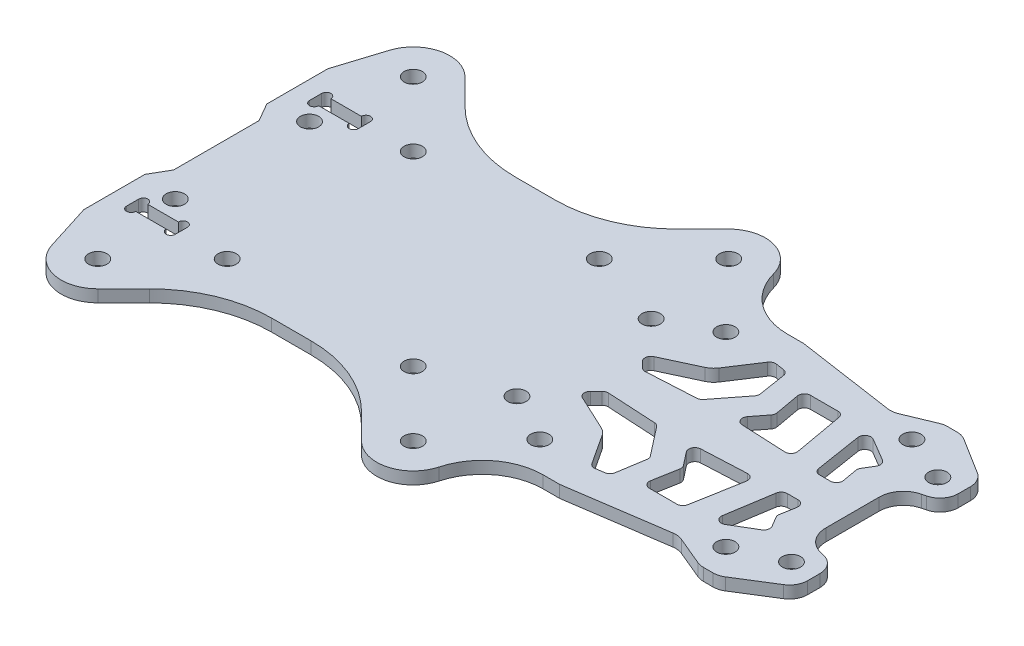
from build123d import *

# Parameters (mm, degrees)
SKETCH1_R           = 1.5
BOSS_EXTRUDE1_DEPTH = 2
FILLET1_R           = 20
FILLET2_R           = 10
FILLET8_DEPTH       = 2
FILLET9_R           = 3
FILLET10_R          = 4
SKETCH2_R           = 1.5
CUT_EXTRUDE1_DEPTH  = 85.27836671
CUT_EXTRUDE2_DEPTH  = 85.27836671
FILLET11_R          = 1
FILLET12_R          = 3


with BuildPart() as part:
    # Sketch1 → Boss-Extrude1 (new body)
    with BuildSketch(Plane(origin=(0, 0, 0), x_dir=(1, 0, 0), z_dir=(0, 1, 0))):
        with BuildLine():
            Line((-28.485281374, 20), (-34, 20))
            Line((-34, 20), (-34, 9.992729247))
            Line((-34, 9.992729247), (-32.274190039, 6.998022761))
            Line((-32.274190039, 6.998022761), (-32.274190039, -7))
            Line((-32.274190039, -7), (-34, -9.992734036))
            Line((-34, -9.992734036), (-34, -20))
            Line((-34, -20), (-28.485281374, -20))
            Line((-28.485281374, -20), (-30.099242405, -21.613961031))
            ThreePointArc((-30.099242405, -21.613961031), (-30.099242405, -30.099242405), (-21.613961031, -30.099242405))
            Line((-21.613961031, -30.099242405), (-11.514718626, -20))
            Line((-11.514718626, -20), (11.514718626, -20))
            Line((11.514718626, -20), (21.613961031, -30.099242405))
            ThreePointArc((21.613961031, -30.099242405), (30.099242405, -30.099242405), (30.099242405, -21.613961031))
            Line((30.099242405, -21.613961031), (28.485281374, -20))
            Line((28.485281374, -20), (44, -20))
            Line((44, -20), (61, -17.5))
            Line((61, -17.5), (67, -20))
            Line((67, -20), (70, -20))
            Line((70, -20), (78, -15))
            Line((78, -15), (78, -9))
            Line((78, -9), (72, -7.5))
            Line((72, -7.5), (72, 7.5))
            Line((72, 7.5), (78, 9))
            Line((78, 9), (78, 15))
            Line((78, 15), (70, 20))
            Line((70, 20), (67, 20))
            Line((67, 20), (61, 17.5))
            Line((61, 17.5), (44, 20))
            Line((44, 20), (28.485281374, 20))
            Line((28.485281374, 20), (30.099242405, 21.613961031))
            ThreePointArc((30.099242405, 21.613961031), (30.099242405, 30.099242405), (21.613961031, 30.099242405))
            Line((21.613961031, 30.099242405), (11.514718626, 20))
            Line((11.514718626, 20), (-11.514718626, 20))
            Line((-11.514718626, 20), (-21.613961031, 30.099242405))
            ThreePointArc((-21.613961031, 30.099242405), (-30.099242405, 30.099242405), (-30.099242405, 21.613961031))
            Line((-30.099242405, 21.613961031), (-28.485281374, 20))
        make_face()
        with Locations(Location((-25.856601718, -25.856601718, 0), (0, 0, 270))):
            Circle(SKETCH1_R, mode=Mode.SUBTRACT)
        with BuildLine():
            ThreePointArc((-24.5, -14), (-23.75, -13.25), (-23, -14))
            Line((-23, -14), (-23, -16))
            ThreePointArc((-23, -16), (-23.75, -16.75), (-24.5, -16))
            Line((-24.5, -16), (-29.5, -16))
            ThreePointArc((-29.5, -16), (-30.25, -16.75), (-31, -16))
            Line((-31, -16), (-31, -14))
            ThreePointArc((-31, -14), (-30.25, -13.25), (-29.5, -14))
            Line((-29.5, -14), (-24.5, -14))
        make_face(mode=Mode.SUBTRACT)
        with Locations(Location((-28, -11, 0), (0, 0, 270))):
            Circle(SKETCH1_R, mode=Mode.SUBTRACT)
        with Locations(Location((-15.25, -15.25, 0), (0, 0, 270))):
            Circle(SKETCH1_R, mode=Mode.SUBTRACT)
        with Locations(Location((15.25, -15.25, 0), (0, 0, 270))):
            Circle(SKETCH1_R, mode=Mode.SUBTRACT)
        with Locations(Location((28, -11, 0), (0, 0, 270))):
            Circle(SKETCH1_R, mode=Mode.SUBTRACT)
        with Locations(Location((74, -12, 0), (0, 0, 270))):
            Circle(SKETCH1_R, mode=Mode.SUBTRACT)
        with Locations(Location((-28, 11, 0), (0, 0, 270))):
            Circle(SKETCH1_R, mode=Mode.SUBTRACT)
        with BuildLine():
            Line((-23, 16), (-23, 14))
            ThreePointArc((-23, 14), (-23.75, 13.25), (-24.5, 14))
            Line((-24.5, 14), (-29.5, 14))
            ThreePointArc((-29.5, 14), (-30.25, 13.25), (-31, 14))
            Line((-31, 14), (-31, 16))
            ThreePointArc((-31, 16), (-30.25, 16.75), (-29.5, 16))
            Line((-29.5, 16), (-24.5, 16))
            ThreePointArc((-24.5, 16), (-23.75, 16.75), (-23, 16))
        make_face(mode=Mode.SUBTRACT)
        with Locations(Location((-15.25, 15.25, 0), (0, 0, 270))):
            Circle(SKETCH1_R, mode=Mode.SUBTRACT)
        with Locations(Location((15.25, 15.25, 0), (0, 0, 270))):
            Circle(SKETCH1_R, mode=Mode.SUBTRACT)
        with Locations(Location((28, 11, 0), (0, 0, 270))):
            Circle(SKETCH1_R, mode=Mode.SUBTRACT)
        with Locations(Location((74, 12, 0), (0, 0, 270))):
            Circle(SKETCH1_R, mode=Mode.SUBTRACT)
        with Locations(Location((-25.856601718, 25.856601718, 0), (0, 0, 270))):
            Circle(SKETCH1_R, mode=Mode.SUBTRACT)
        with Locations(Location((25.856601718, 25.856601718, 0), (0, 0, 270))):
            Circle(SKETCH1_R, mode=Mode.SUBTRACT)
        with Locations(Location((25.856601718, -25.856601718, 0), (0, 0, 270))):
            Circle(SKETCH1_R, mode=Mode.SUBTRACT)
    extrude(amount=BOSS_EXTRUDE1_DEPTH)

    # Fillet1
    fillet1_edges = [part.edges().sort_by_distance(p)[0] for p in [
        (-11.514718626, 1, -20),
        (11.514718626, 1, -20),
        (11.514718626, 1, 20),
        (-11.514718626, 1, 20),
    ]]
    fillet(fillet1_edges, radius=FILLET1_R)

    # Fillet2
    fillet2_edges = [part.edges().sort_by_distance(p)[0] for p in [
        (28.485281374, 1, -20),
        (28.485281374, 1, 20),
    ]]
    fillet(fillet2_edges, radius=FILLET2_R)

    # Fillet8: read off the stored shape, not the designer's step
    # Fillet8 outline → Fillet8 (add)
    with BuildSketch(Plane(origin=(0, 0, 0), x_dir=(1, 0, 0), z_dir=(0, 1, 0))):
        with BuildLine():
            ThreePointArc((-31.578419532, 27.662370502), (-32.788440089, 23.830942006), (-34, 20))
            Line((-34, 20), (-28.485281374, 20))
            Line((-28.485281374, 20), (-30.099242405, 21.613961031))
            ThreePointArc((-30.099242405, 21.613961031), (-31.684845243, 24.431267578), (-31.578419532, 27.662370502))
        make_face()
        with BuildLine():
            ThreePointArc((-34, -20), (-32.788440089, -23.830942006), (-31.578419532, -27.662370502))
            ThreePointArc((-31.578419532, -27.662370502), (-31.684845243, -24.431267578), (-30.099242405, -21.613961031))
            Line((-30.099242405, -21.613961031), (-28.485281374, -20))
            Line((-28.485281374, -20), (-34, -20))
        make_face()
    extrude(amount=FILLET8_DEPTH)

    # Fillet9
    fillet9_edges = [part.edges().sort_by_distance(p)[0] for p in [
        (61, 1, -17.5),
        (67, 1, -20),
        (70, 1, -20),
        (78, 1, -15),
        (78, 1, -9),
        (78, 1, 9),
        (78, 1, 15),
        (70, 1, 20),
        (67, 1, 20),
        (61, 1, 17.5),
    ]]
    fillet(fillet9_edges, radius=FILLET9_R)

    # Fillet10
    fillet10_edges = [part.edges().sort_by_distance(p)[0] for p in [
        (72, 1, -7.5),
        (72, 1, 7.5),
    ]]
    fillet(fillet10_edges, radius=FILLET10_R)

    # Sketch2 → Cut-Extrude1 (cut, through all)
    with BuildSketch(Plane(origin=(0, 2, 0), x_dir=(1, 0, 0), z_dir=(0, 1, 0))):
        with Locations(Location((66.5, -15.25, 0), (0, 0, 270))):
            Circle(SKETCH2_R)
        with Locations(Location((66.5, 15.25, 0), (0, 0, 270))):
            Circle(SKETCH2_R)
        with Locations(Location((36, -15.25, 0), (0, 0, 270))):
            Circle(SKETCH2_R)
        with Locations(Location((36, 15.25, 0), (0, 0, 270))):
            Circle(SKETCH2_R)
    extrude(amount=-CUT_EXTRUDE1_DEPTH, mode=Mode.SUBTRACT)

    # Sketch3 → Cut-Extrude2 (cut, through all)
    with BuildSketch(Plane(origin=(0, 2, 0), x_dir=(1, 0, 0), z_dir=(0, 1, 0))):
        Polygon((34.569062784, -3), (32.311365363, -5.257697421), (40.083766321, -8.884817868), (44.04629349, -14.939415582), (46.774410022, -14.538221974), (47.68263762, -8.884817868), (43.478247161, -3.49719071), align=None)
        Polygon((59.073968106, -3), (48.593588886, -3.49719071), (51.74688173, -7.526398233), (50.730820703, -13.202325352), (57.247625913, -13.202325352), align=None)
        Polygon((63.114876648, -2.645444048), (61.446344058, -13.202325352), (67.86927054, -9.396866308), (66.21976999, -6.612807763), (66.929977074, -2.645444048), align=None)
        Polygon((44.04629349, 14.939415582), (40.083766321, 8.884817868), (32.311365363, 5.257697421), (34.569062784, 3), (43.478247161, 3.49719071), (47.68263762, 8.884817868), (46.774410022, 14.538221974), align=None)
        Polygon((61.446344058, 13.202325352), (63.114876648, 2.645444048), (66.929977074, 2.645444048), (66.21976999, 6.612807763), (67.86927054, 9.396866308), align=None)
        Polygon((48.593588886, 3.49719071), (59.073968106, 3), (57.247625913, 13.202325352), (50.730820703, 13.202325352), (51.74688173, 7.526398233), align=None)
    extrude(amount=-CUT_EXTRUDE2_DEPTH, mode=Mode.SUBTRACT)

    # Fillet11
    fillet11_edges = [part.edges().sort_by_distance(p)[0] for p in [
        (32.311365363, 1, -5.257697421),
        (44.04629349, 1, -14.939415582),
        (46.774410022, 1, -14.538221974),
        (47.68263762, 1, -8.884817868),
        (43.478247161, 1, -3.49719071),
        (34.569062784, 1, -3),
        (61.446344058, 1, -13.202325352),
        (67.86927054, 1, -9.396866308),
        (66.21976999, 1, -6.612807763),
        (66.929977074, 1, -2.645444048),
        (63.114876648, 1, -2.645444048),
        (48.593588886, 1, -3.49719071),
        (51.74688173, 1, -7.526398233),
        (50.730820703, 1, -13.202325352),
        (57.247625913, 1, -13.202325352),
        (59.073968106, 1, -3),
        (59.073968106, 1, 3),
        (57.247625913, 1, 13.202325352),
        (50.730820703, 1, 13.202325352),
        (51.74688173, 1, 7.526398233),
        (48.593588886, 1, 3.49719071),
        (63.114876648, 1, 2.645444048),
        (66.929977074, 1, 2.645444048),
        (66.21976999, 1, 6.612807763),
        (67.86927054, 1, 9.396866308),
        (61.446344058, 1, 13.202325352),
        (32.311365363, 1, 5.257697421),
        (34.569062784, 1, 3),
        (43.478247161, 1, 3.49719071),
        (47.68263762, 1, 8.884817868),
        (46.774410022, 1, 14.538221974),
        (44.04629349, 1, 14.939415582),
    ]]
    fillet(fillet11_edges, radius=FILLET11_R)

    # Fillet12
    fillet12_edges = [part.edges().sort_by_distance(p)[0] for p in [
        (40.083766321, 1, -8.884817868),
        (40.083766321, 1, 8.884817868),
    ]]
    fillet(fillet12_edges, radius=FILLET12_R)


solid = part.part
